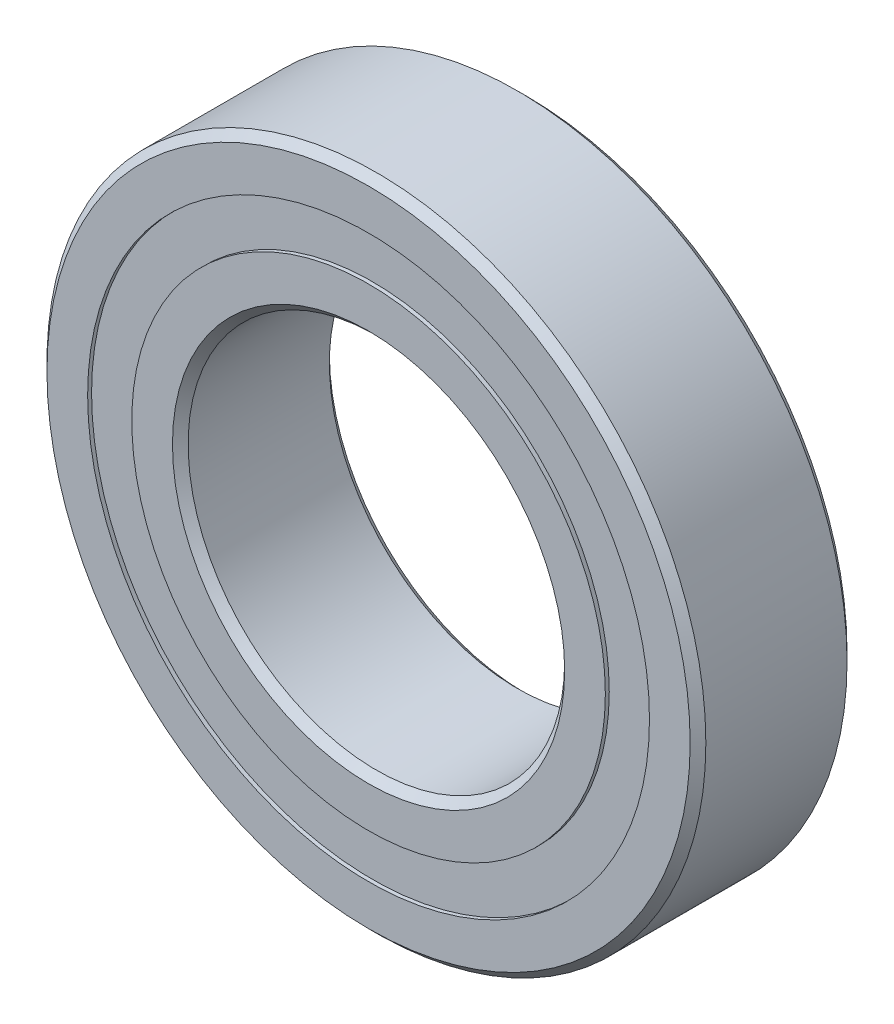
from build123d import *

# Parameters (mm, degrees)
CIRPATTERN1_COUNT = 12
SKETCH5_W         = 1.060011729
SKETCH5_H         = 1.406593406


with BuildPart() as part:
    # Sketch1 → Revolve1 (revolve)
    with BuildSketch(Plane(origin=(0, 0, 0), x_dir=(0, 0, -1), z_dir=(1, 0, 0))):
        with BuildLine():
            Line((2.25, 10.5), (-2.25, 10.5))
            Line((-2.25, 10.5), (-2.5, 10.25))
            Line((-2.5, 10.25), (-2.5, 8.953296703))
            Line((-2.5, 8.953296703), (-1.111111111, 8.953296703))
            ThreePointArc((-1.111111111, 8.953296703), (0, 9.564988271), (1.111111111, 8.953296703))
            Line((1.111111111, 8.953296703), (2.5, 8.953296703))
            Line((2.5, 8.953296703), (2.5, 10.25))
            Line((2.5, 10.25), (2.25, 10.5))
        make_face()
    revolve(axis=Axis((0, 0, 2.5), (0, 0, -1)))


with BuildPart() as body_2:
    # Sketch3 → Revolve3 (revolve)
    with BuildSketch(Plane(origin=(0, 0, 0), x_dir=(0, 0, -1), z_dir=(1, 0, 0))):
        with BuildLine():
            Line((-2.5, 7.546703297), (-1.111111111, 7.546703297))
            ThreePointArc((-1.111111111, 7.546703297), (0, 6.935011729), (1.111111111, 7.546703297))
            Line((1.111111111, 7.546703297), (2.5, 7.546703297))
            Line((2.5, 7.546703297), (2.5, 6.25))
            Line((2.5, 6.25), (2.25, 6))
            Line((2.25, 6), (-2.25, 6))
            Line((-2.25, 6), (-2.5, 6.25))
            Line((-2.5, 6.25), (-2.5, 7.546703297))
        make_face()
    revolve(axis=Axis((0, 0, 2.5), (0, 0, -1)))


with BuildPart() as body_3:
    # Sketch4 → Revolve4 (revolve)
    with BuildSketch(Plane(origin=(0, 0, 0), x_dir=(0, 0, -1), z_dir=(1, 0, 0))):
        with BuildLine():
            Line((-1.314988271, 8.25), (1.314988271, 8.25))
            ThreePointArc((1.314988271, 8.25), (0, 9.564988271), (-1.314988271, 8.25))
        make_face()
    revolve(axis=Axis((0, 8.25, 1.314988271), (0, 0, -1)))


with BuildPart() as cirpattern1_1:
    # CirPattern1: pattern copy
    add(body_3.part.rotate(Axis((0, 0, -2.5), (0, 0, 1)), 1 * 360 / CIRPATTERN1_COUNT))


with BuildPart() as cirpattern1_2:
    # CirPattern1: pattern copy
    add(body_3.part.rotate(Axis((0, 0, -2.5), (0, 0, 1)), 2 * 360 / CIRPATTERN1_COUNT))


with BuildPart() as cirpattern1_3:
    # CirPattern1: pattern copy
    add(body_3.part.rotate(Axis((0, 0, -2.5), (0, 0, 1)), 3 * 360 / CIRPATTERN1_COUNT))


with BuildPart() as cirpattern1_4:
    # CirPattern1: pattern copy
    add(body_3.part.rotate(Axis((0, 0, -2.5), (0, 0, 1)), 4 * 360 / CIRPATTERN1_COUNT))


with BuildPart() as cirpattern1_5:
    # CirPattern1: pattern copy
    add(body_3.part.rotate(Axis((0, 0, -2.5), (0, 0, 1)), 5 * 360 / CIRPATTERN1_COUNT))


with BuildPart() as cirpattern1_6:
    # CirPattern1: pattern copy
    add(body_3.part.rotate(Axis((0, 0, -2.5), (0, 0, 1)), 6 * 360 / CIRPATTERN1_COUNT))


with BuildPart() as cirpattern1_7:
    # CirPattern1: pattern copy
    add(body_3.part.rotate(Axis((0, 0, -2.5), (0, 0, 1)), 7 * 360 / CIRPATTERN1_COUNT))


with BuildPart() as cirpattern1_8:
    # CirPattern1: pattern copy
    add(body_3.part.rotate(Axis((0, 0, -2.5), (0, 0, 1)), 8 * 360 / CIRPATTERN1_COUNT))


with BuildPart() as cirpattern1_9:
    # CirPattern1: pattern copy
    add(body_3.part.rotate(Axis((0, 0, -2.5), (0, 0, 1)), 9 * 360 / CIRPATTERN1_COUNT))


with BuildPart() as cirpattern1_10:
    # CirPattern1: pattern copy
    add(body_3.part.rotate(Axis((0, 0, -2.5), (0, 0, 1)), 10 * 360 / CIRPATTERN1_COUNT))


with BuildPart() as cirpattern1_11:
    # CirPattern1: pattern copy
    add(body_3.part.rotate(Axis((0, 0, -2.5), (0, 0, 1)), 11 * 360 / CIRPATTERN1_COUNT))


with BuildPart() as body_15:
    # Sketch5 → Revolve5 (revolve)
    with BuildSketch(Plane(origin=(0, 0, 0), x_dir=(0, 0, -1), z_dir=(1, 0, 0))):
        with Locations((-1.844994135, 8.25)):
            Rectangle(SKETCH5_W, SKETCH5_H)
        with Locations((1.844994135, 8.25)):
            Rectangle(SKETCH5_W, SKETCH5_H)
    revolve(axis=Axis((0, 0, 2.5), (0, 0, -1)))


solid = Compound([part.part, body_2.part, body_3.part, cirpattern1_1.part, cirpattern1_2.part, cirpattern1_3.part, cirpattern1_4.part, cirpattern1_5.part, cirpattern1_6.part, cirpattern1_7.part, cirpattern1_8.part, cirpattern1_9.part, cirpattern1_10.part, cirpattern1_11.part, body_15.part])
